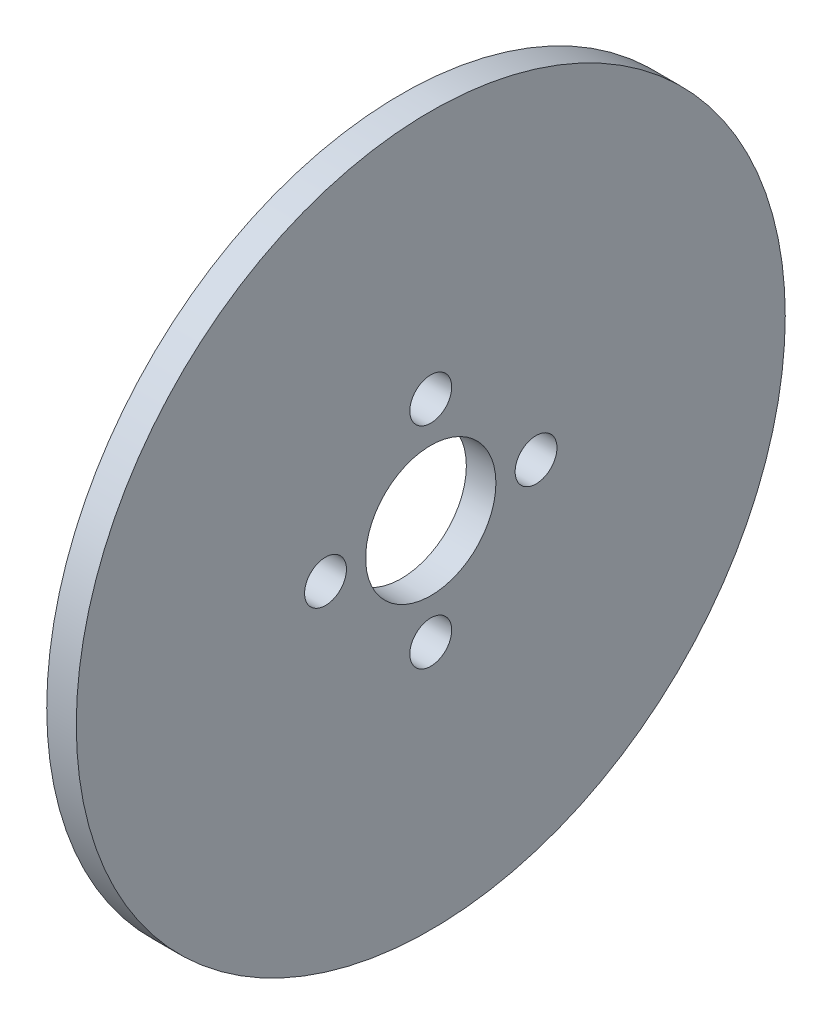
from build123d import *

# Parameters (mm, degrees)
SKETCH1_R           = 38.1
SKETCH1_R_2         = 7
BOSS_EXTRUDE2_DEPTH = 3.175
SKETCH4_R           = 2.25
CUT_EXTRUDE3_DEPTH  = 30.394


with BuildPart() as part:
    # Sketch1 → Boss-Extrude2 (new body)
    with BuildSketch(Plane.YZ):
        Circle(SKETCH1_R)
        Circle(SKETCH1_R_2, mode=Mode.SUBTRACT)
    extrude(amount=BOSS_EXTRUDE2_DEPTH)

    # Sketch4 → Cut-Extrude3 (cut)
    with BuildSketch(Plane.YZ.offset(3.175)):
        with Locations((0, 11.313708499)):
            Circle(SKETCH4_R)
        with Locations((11.313708499, 0)):
            Circle(SKETCH4_R)
        with Locations((-11.313708499, 0)):
            Circle(SKETCH4_R)
        with Locations((0, -11.313708499)):
            Circle(SKETCH4_R)
    extrude(amount=-CUT_EXTRUDE3_DEPTH, mode=Mode.SUBTRACT)


solid = part.part
